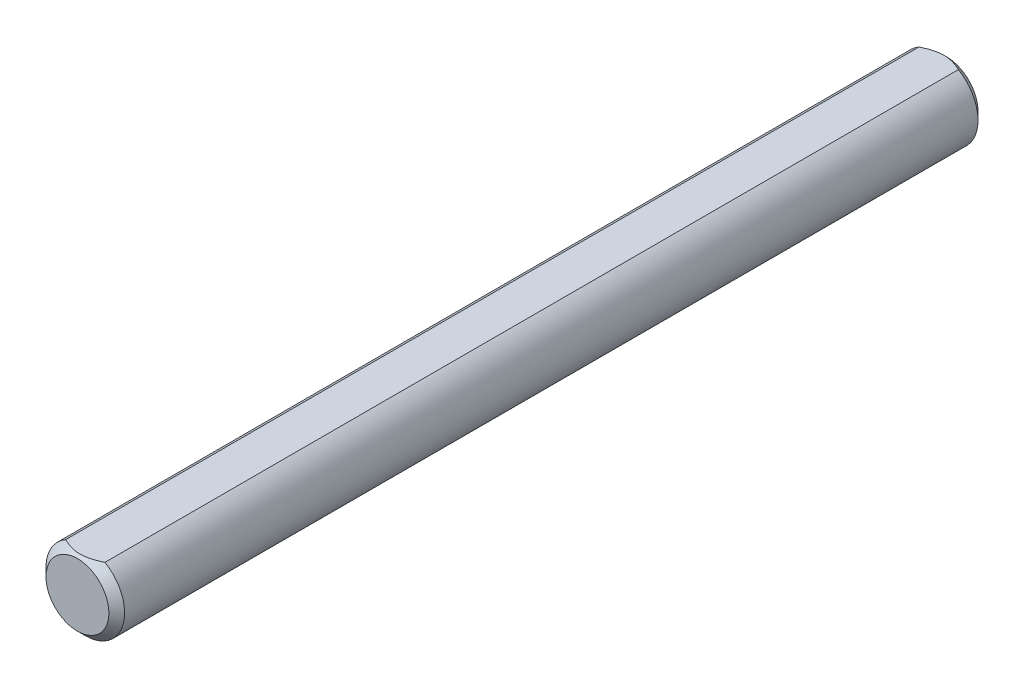
from build123d import *

# Parameters (mm, degrees)
SKETCH1_R           = 3.175
EXTRUDE1_DEPTH      = 35.08375
CHAMFER1_SIZE       = 0.635
EXTRUDE7_DEPTH      = 36.369913261
EXTRUDE7_DEPTH_BACK = 36.369913261


with BuildPart() as part:
    # Sketch1 → Extrude1 (new, symmetric)
    with BuildSketch(Plane.XY):
        Circle(SKETCH1_R)
    extrude(amount=EXTRUDE1_DEPTH, both=True)

    # Chamfer1
    chamfer1_edges = [part.edges().sort_by_distance(p)[0] for p in [
        (-3.175, 0, -35.08375),
        (-3.175, 0, 35.08375),
    ]]
    chamfer(chamfer1_edges, length=CHAMFER1_SIZE)

    # Sketch13 → Extrude7 (cut, two sides: drawn at the far end of the back side and taken through both)
    with BuildSketch(Plane.XY.offset(-EXTRUDE7_DEPTH_BACK)):
        with BuildLine():
            Line((-1.5875, 2.749630657), (1.5875, 2.749630657))
            ThreePointArc((1.5875, 2.749630657), (0, 3.175), (-1.5875, 2.749630657))
        make_face()
    extrude(amount=EXTRUDE7_DEPTH + EXTRUDE7_DEPTH_BACK, mode=Mode.SUBTRACT)


solid = part.part
